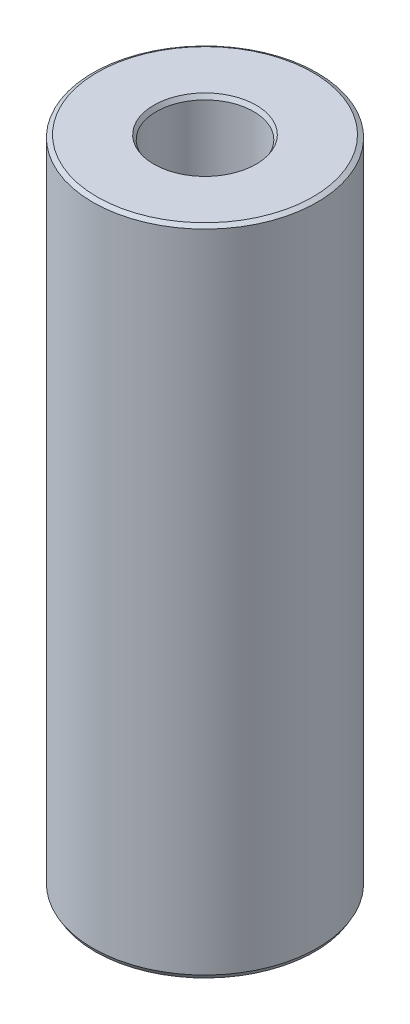
from build123d import *
from OCP.BRepFilletAPI import BRepFilletAPI_MakeChamfer

# Parameters (mm, degrees)
SKETCH1_R           = 50
BOSS_EXTRUDE1_DEPTH = 291.016992526
SKETCH2_R           = 21.705718129
CUT_EXTRUDE1_DEPTH  = 300.484373447
CHAMFER1_SIZE       = 1.106734401
CHAMFER1_SIZE2      = 1.916920213


with BuildPart() as part:
    # Sketch1 → Boss-Extrude1 (new body)
    with BuildSketch(Plane(origin=(0, 0, 0), x_dir=(1, 0, 0), z_dir=(0, 1, 0))):
        Circle(SKETCH1_R)
    extrude(amount=BOSS_EXTRUDE1_DEPTH)

    # Sketch2 → Cut-Extrude1 (cut, through all)
    with BuildSketch(Plane(origin=(0, 0, 0), x_dir=(1, 0, 0), z_dir=(0, 1, 0))):
        Circle(SKETCH2_R)
    extrude(amount=CUT_EXTRUDE1_DEPTH, mode=Mode.SUBTRACT)

    # Chamfer1: one chamfer whose edges measure the first distance from different faces: ONE call of the kernel's chamfer builder (chamfer() names one face for all edges)
    chamfer1_edges_1 = [part.edges().sort_by_distance(p)[0] for p in [
        (-21.705718129, 291.016992526, 0),
    ]]
    chamfer1_side_1 = [part.faces().sort_by_distance(p)[0] for p in [
        (-48.585786438, 291.016992526, 0),
    ]]
    chamfer1_edges_2 = [part.edges().sort_by_distance(p)[0] for p in [
        (-21.705718129, 0, 0),
    ]]
    chamfer1_side_2 = [part.faces().sort_by_distance(p)[0] for p in [
        (-21.705718129, 145.508496263, 0),
    ]]
    chamfer1_edges_3 = [part.edges().sort_by_distance(p)[0] for p in [
        (-50, 0, 0),
    ]]
    chamfer1_side_3 = [part.faces().sort_by_distance(p)[0] for p in [
        (-48.585786438, 0, 0),
    ]]
    chamfer1_edges_4 = [part.edges().sort_by_distance(p)[0] for p in [
        (-50, 291.016992526, 0),
    ]]
    chamfer1_side_4 = [part.faces().sort_by_distance(p)[0] for p in [
        (-50, 145.508496263, 0),
    ]]
    chamfer1 = BRepFilletAPI_MakeChamfer(part.part.solid().wrapped)
    for e in chamfer1_edges_1:
        chamfer1.Add(CHAMFER1_SIZE, CHAMFER1_SIZE2, e.wrapped, chamfer1_side_1[0].wrapped)  # the first distance lies on this face
    for e in chamfer1_edges_2:
        chamfer1.Add(CHAMFER1_SIZE, CHAMFER1_SIZE2, e.wrapped, chamfer1_side_2[0].wrapped)  # the first distance lies on this face
    for e in chamfer1_edges_3:
        chamfer1.Add(CHAMFER1_SIZE, CHAMFER1_SIZE2, e.wrapped, chamfer1_side_3[0].wrapped)  # the first distance lies on this face
    for e in chamfer1_edges_4:
        chamfer1.Add(CHAMFER1_SIZE, CHAMFER1_SIZE2, e.wrapped, chamfer1_side_4[0].wrapped)  # the first distance lies on this face
    add(Compound.cast(chamfer1.Shape()), mode=Mode.REPLACE)


solid = part.part
